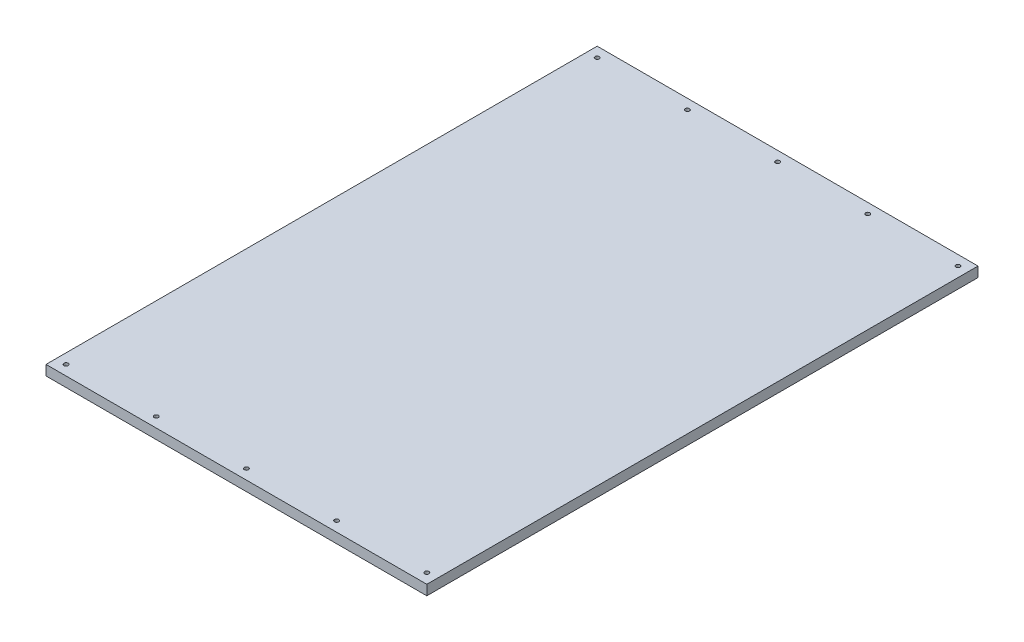
from build123d import *

# Parameters (mm, degrees)
SKETCH1_W           = 380
SKETCH1_H           = 550
BOSS_EXTRUDE1_DEPTH = 10
SKETCH2_R           = 2.1
CUT_EXTRUDE1_DEPTH  = 10


with BuildPart() as part:
    # Sketch1 → Boss-Extrude1 (new body)
    with BuildSketch(Plane(origin=(0, 0, 0), x_dir=(1, 0, 0), z_dir=(0, 1, 0))):
        Rectangle(SKETCH1_W, SKETCH1_H)
    extrude(amount=BOSS_EXTRUDE1_DEPTH)

    # Sketch2 → Cut-Extrude1 (cut)
    with BuildSketch(Plane(origin=(0, 10, 0), x_dir=(1, 0, 0), z_dir=(0, 1, 0))):
        with Locations((0, 265)):
            Circle(SKETCH2_R)
        with Locations((90, 265)):
            Circle(SKETCH2_R)
        with Locations((180, 265)):
            Circle(SKETCH2_R)
        with Locations((-90, 265)):
            Circle(SKETCH2_R)
        with Locations((-180, 265)):
            Circle(SKETCH2_R)
        with Locations((180, -265)):
            Circle(SKETCH2_R)
        with Locations((90, -265)):
            Circle(SKETCH2_R)
        with Locations((0, -265)):
            Circle(SKETCH2_R)
        with Locations((-90, -265)):
            Circle(SKETCH2_R)
        with Locations((-180, -265)):
            Circle(SKETCH2_R)
    extrude(amount=-CUT_EXTRUDE1_DEPTH, mode=Mode.SUBTRACT)


solid = part.part
